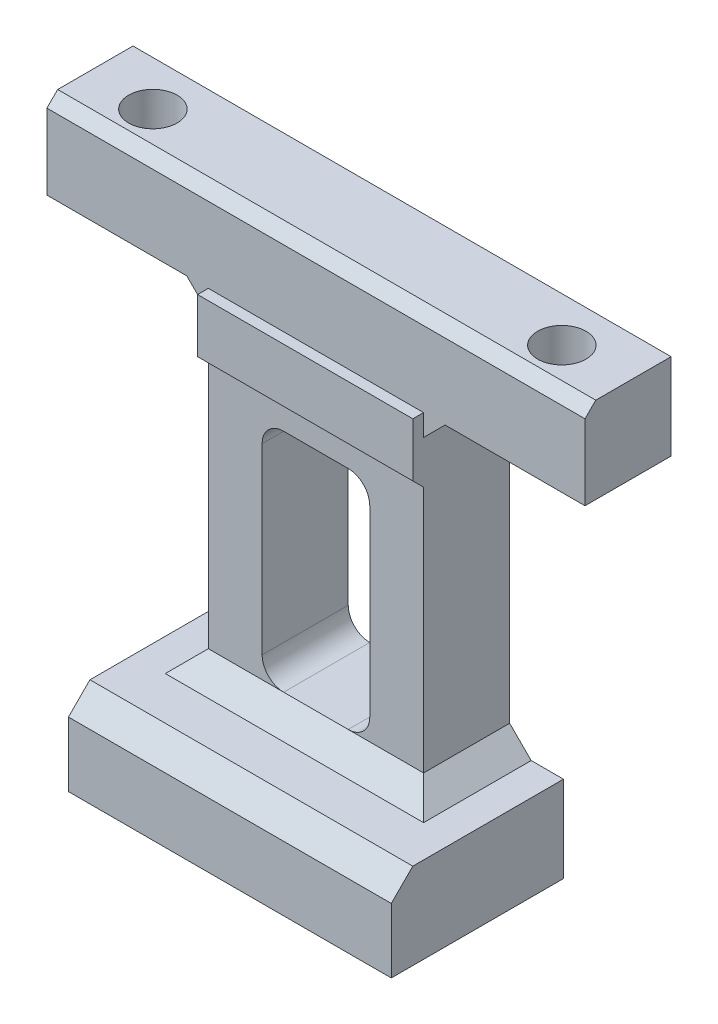
from build123d import *

# Parameters (mm, degrees)
EXTRUDE_1_DEPTH     = 8
SKETCH_3_W          = 20
SKETCH_3_H          = 4
EXTRUDE_2_DEPTH     = 1
SKETCH_4_R          = 2.25
CUT_EXTRUDE_3_DEPTH = 10
CHAMFER_2_SIZE      = 1
CHAMFER_3_SIZE      = 2
CHAMFER_4_SIZE      = 2
SKETCH_6_W          = 20
SKETCH_6_H          = 8
EXTRUDE_3_DEPTH     = 8
SKETCH_7_W          = 10
SKETCH_7_H          = 21
CUT_EXTRUDE_4_DEPTH = 54.833075335
FILLET_1_R          = 2
SKETCH_8_R          = 2.4
CUT_EXTRUDE_5_DEPTH = 6
SKETCH_9_W          = 5
SKETCH_9_H          = 8
EXTRUDE_4_DEPTH     = 16
CHAMFER_5_SIZE      = 2
CHAMFER_6_SIZE      = 2


# Some blends are built 0.0001 mm under size
with BuildPart() as part:
    # ｽｹｯﾁ1 → ﾎﾞｽ - 押し出し1 (new body)
    with BuildSketch(Plane.XY):
        Polygon((-10, 0), (0, 0), (10, 0), (10, 5), (0, 5), (-10, 5), align=None)
        Polygon((0, 5), (10, 5), (10, 39), (-10, 39), (-10, 5), align=None)
        Polygon((-10, 39), (10, 39), (25, 39), (25, 47), (-25, 47), (-25, 39), align=None)
    extrude(amount=-EXTRUDE_1_DEPTH)

    # ｽｹｯﾁ3 → ﾎﾞｽ - 押し出し2 (add)
    with BuildSketch(Plane.XY):
        with Locations((0, 37)):
            Rectangle(SKETCH_3_W, SKETCH_3_H)
    extrude(amount=EXTRUDE_2_DEPTH)

    # ｽｹｯﾁ4 → ｶｯﾄ - 押し出し3 (cut)
    with BuildSketch(Plane(origin=(0, 47, 0), x_dir=(1, 0, 0), z_dir=(0, 1, 0))):
        with Locations(Location((19, 3.847406514, 0), (0, 0, 180))):
            Circle(SKETCH_4_R)
        with Locations(Location((-19, 3.847406514, 0), (0, 0, 180))):
            Circle(SKETCH_4_R)
    extrude(amount=-CUT_EXTRUDE_3_DEPTH, mode=Mode.SUBTRACT)

    # 面取り2
    chamfer_2_edges = [part.edges().sort_by_distance(p)[0] for p in [
        (0, 47, 0),
    ]]
    chamfer(chamfer_2_edges, length=CHAMFER_2_SIZE)

    # 面取り3
    chamfer_3_edges = [part.edges().sort_by_distance(p)[0] for p in [
        (-10, 39, -4),
        (10, 39, -4),
    ]]
    chamfer(chamfer_3_edges, length=CHAMFER_3_SIZE)

    # 面取り4
    # the kernel refuses this chamfer: 2 mm, written as the material it adds along each edge
    with BuildSketch(Plane(origin=(10, 35, 0), x_dir=(0, -0.9996219169112968, -0.02749587661058639), z_dir=(-1, 0, 0))) as chamfer_4_piece_1_section:
        Polygon((CHAMFER_4_SIZE * 0.999621916911, CHAMFER_4_SIZE * 0.0274958766106), (-CHAMFER_4_SIZE * 0.0274958766106, CHAMFER_4_SIZE * 0.999621916911), (0, 0), align=None)
    chamfer_4_piece_1 = extrude(amount=20, mode=Mode.PRIVATE)
    chamfer_4_piece_1 = split(chamfer_4_piece_1, bisect_by=Plane(origin=(0, 34.213197832, 1), z_dir=(0, 0, -1)), keep=Keep.TOP, mode=Mode.PRIVATE)
    add(chamfer_4_piece_1)

    # ｽｹｯﾁ6 → ﾎﾞｽ - 押し出し3 (add)
    with BuildSketch(Plane.XY):
        with Locations((0, 4)):
            Rectangle(SKETCH_6_W, SKETCH_6_H)
    extrude(amount=EXTRUDE_3_DEPTH)

    # ｽｹｯﾁ7 → ｶｯﾄ - 押し出し4 (cut, through all)
    with BuildSketch(Plane.XY):
        with Locations((0, 20.5)):
            Rectangle(SKETCH_7_W, SKETCH_7_H)
    extrude(amount=-CUT_EXTRUDE_4_DEPTH, mode=Mode.SUBTRACT)

    # ﾌｨﾚｯﾄ1
    fillet_1_edges = [part.edges().sort_by_distance(p)[0] for p in [
        (5, 31, -4),
        (5, 10, -4),
        (-5, 10, -4),
        (-5, 31, -4),
    ]]
    fillet(fillet_1_edges, radius=FILLET_1_R)

    # ｽｹｯﾁ8 → ｶｯﾄ - 押し出し5 (cut)
    with BuildSketch(Plane.XZ):
        with Locations(Location((-6, 0, 0), (0, 0, 270))):
            Circle(SKETCH_8_R)
        with Locations(Location((6, 0, 0), (0, 0, 270))):
            Circle(SKETCH_8_R)
    extrude(amount=-CUT_EXTRUDE_5_DEPTH, mode=Mode.SUBTRACT)

    # ｽｹｯﾁ9 → ﾎﾞｽ - 押し出し4 (add)
    with BuildSketch(Plane.XY.offset(8)):
        with Locations((12.5, 4)):
            Rectangle(SKETCH_9_W, SKETCH_9_H)
        with Locations((-12.5, 4)):
            Rectangle(SKETCH_9_W, SKETCH_9_H)
    extrude(amount=-EXTRUDE_4_DEPTH)

    # 面取り5
    chamfer_5_edges = [part.edges().sort_by_distance(p)[0] for p in [
        (0, 8, 8),
    ]]
    chamfer(chamfer_5_edges, length=CHAMFER_5_SIZE)

    # 面取り6
    chamfer_6_edges = [part.edges().sort_by_distance(p)[0] for p in [
        (0, 8, 0),
        (10, 8, -4),
        (-10, 8, -4),
    ]]
    chamfer(chamfer_6_edges, length=CHAMFER_6_SIZE - 0.0001)  # a hair under: the kernel refuses the full size


solid = part.part
